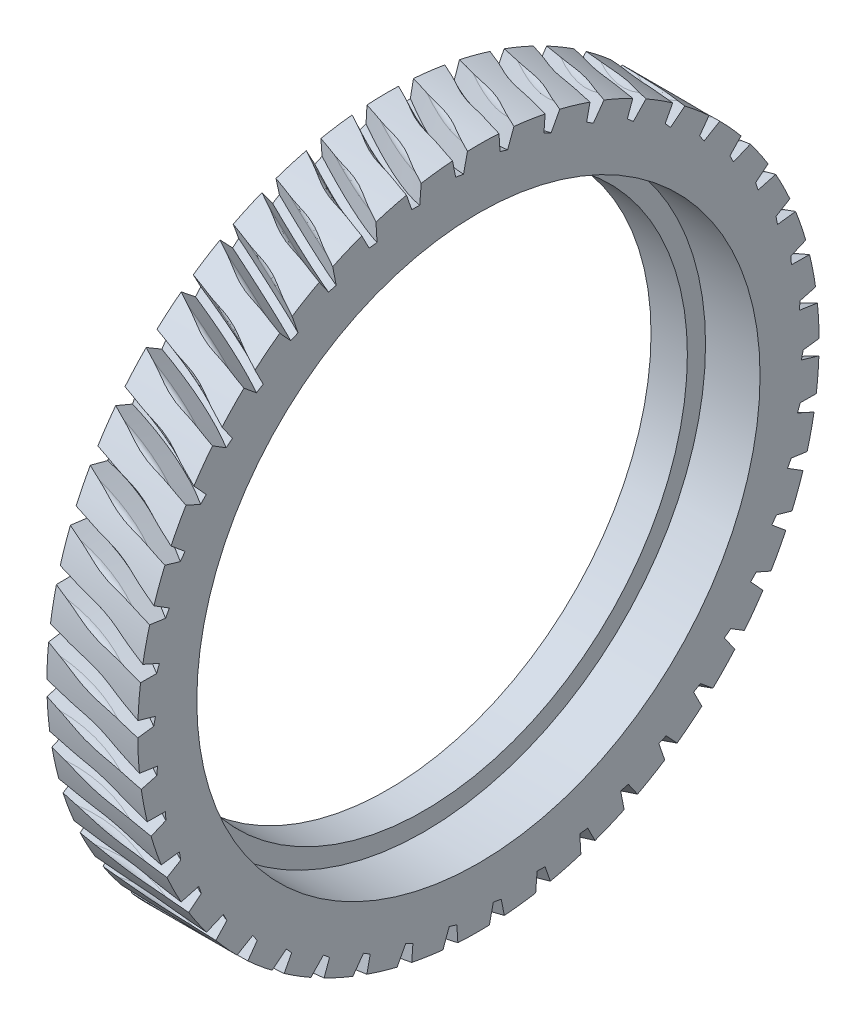
from build123d import *

# Parameters (mm, degrees)
R_P_TITION_CIRCULAIRE1_COUNT = 46


with BuildPart() as part:
    # Esquisse1 → Base-Révolution (revolve)
    with BuildSketch(Plane.XY):
        Polygon((0, 31), (0, 37.5), (-10, 37.5), (-10, 29), (-6, 29), (-6, 31), align=None)
    revolve(axis=Axis((0, 0, 0), (1, 0, 0)))

    # Esquisse4 → Enlever de la matière-Révolution1 (revolve, cut)
    with BuildSketch(Plane(origin=(-4.267766953, 0, -1.767766953), x_dir=(-0.3826834323650815, 0, 0.9238795325112903), z_dir=(-0.9238795325112903, 0, -0.3826834323650815))):
        with BuildLine():
            Line((1.001599732, 36.907911691), (1.513417162, 34.5))
            Line((1.513417162, 34.5), (2.313417162, 34.5))
            Line((2.313417162, 34.5), (2.825234592, 36.907911691))
            ThreePointArc((2.825234592, 36.907911691), (3.174061801, 37.477145961), (3.803382192, 37.7))
            Line((3.803382192, 37.7), (8.1, 37.7))
            Line((8.1, 37.7), (8.1, 39.7))
            Line((8.1, 39.7), (-3.9, 39.7))
            Line((-3.9, 39.7), (-3.9, 37.7))
            Line((-3.9, 37.7), (0.023452131, 37.7))
            ThreePointArc((0.023452131, 37.7), (0.652772522, 37.477145961), (1.001599732, 36.907911691))
        make_face()
    enlever_de_la_mati_re_r_volution1 = revolve(axis=Axis((1.051532757, 48.5, -14.609692455), (-0.38268343236508157, 0, 0.9238795325112902)), mode=Mode.SUBTRACT)

    # Répétition circulaire1: Enlever de la matière-Révolution1 ×46 about axis
    r_p_tition_circulaire1_axis = Axis((0, 0, 0), (1, 0, 0))
    for i in range(1, R_P_TITION_CIRCULAIRE1_COUNT):
        add(enlever_de_la_mati_re_r_volution1.rotate(r_p_tition_circulaire1_axis, i * 360 / R_P_TITION_CIRCULAIRE1_COUNT), mode=Mode.SUBTRACT)


solid = part.part
